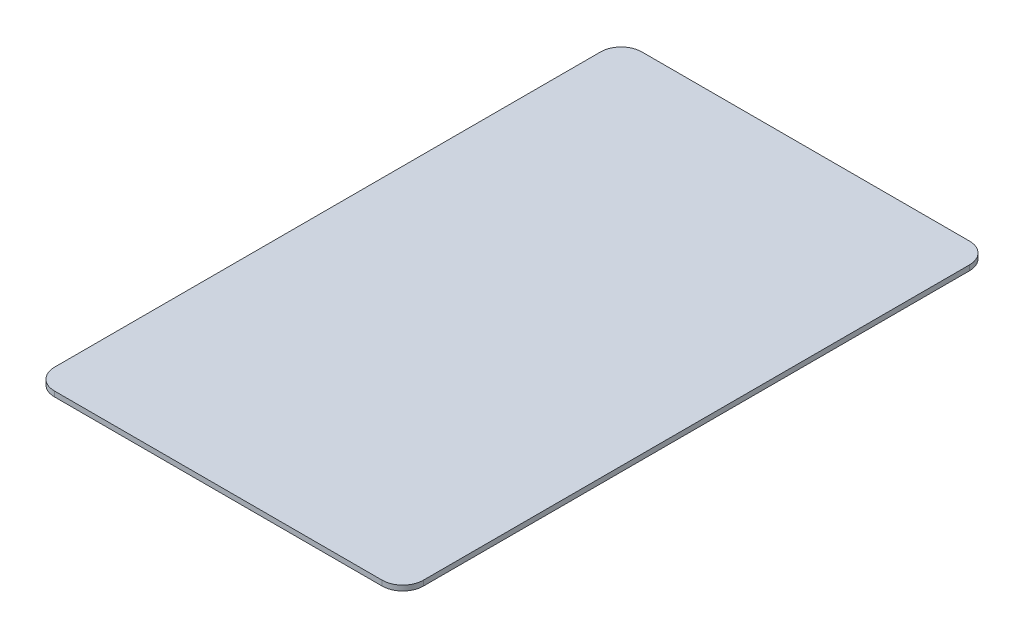
from build123d import *

# Parameters (mm, degrees)
BOSS_EXTRUDE1_DEPTH = 0.5


with BuildPart() as part:
    # Sketch3 → Boss-Extrude1 (new body)
    with BuildSketch(Plane(origin=(0, 0, 0), x_dir=(1, 0, 0), z_dir=(0, 1, 0))):
        with BuildLine():
            Line((-15.9, -28.5), (15.9, -28.5))
            ThreePointArc((15.9, -28.5), (17.314213562, -27.914213562), (17.9, -26.5))
            Line((17.9, -26.5), (17.9, 26.5))
            ThreePointArc((17.9, 26.5), (17.314213562, 27.914213562), (15.9, 28.5))
            Line((15.9, 28.5), (-15.9, 28.5))
            ThreePointArc((-15.9, 28.5), (-17.314213562, 27.914213562), (-17.9, 26.5))
            Line((-17.9, 26.5), (-17.9, -26.5))
            ThreePointArc((-17.9, -26.5), (-17.314213562, -27.914213562), (-15.9, -28.5))
        make_face()
    extrude(amount=BOSS_EXTRUDE1_DEPTH)


solid = part.part
